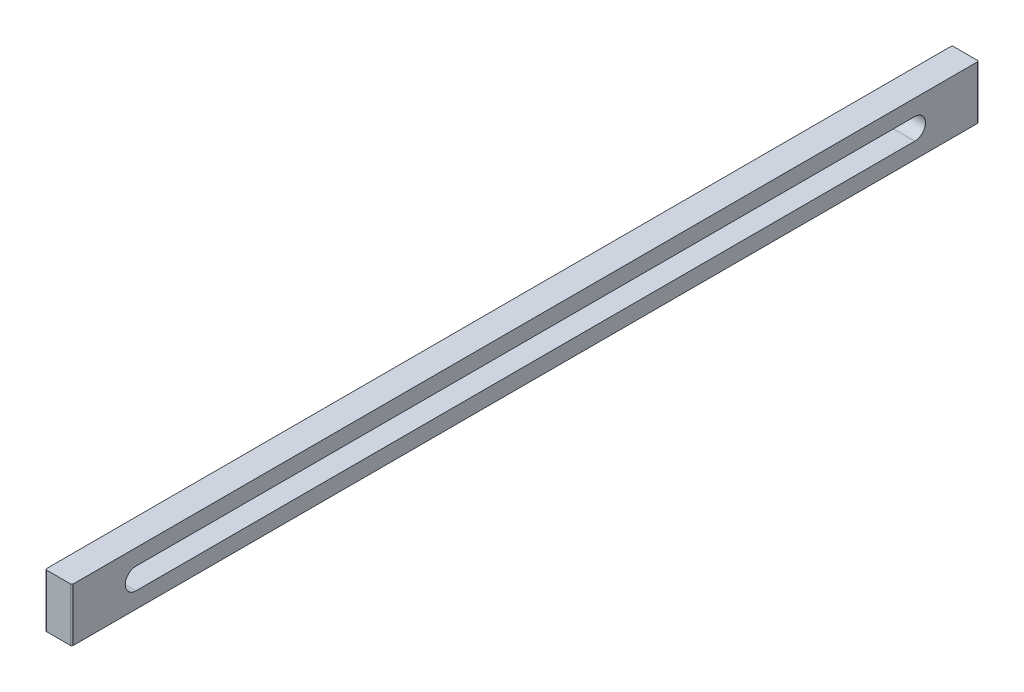
from build123d import *

# Parameters (mm, degrees)
BOSS_EXTRUDE1_DEPTH = 10
CUT_EXTRUDE1_DEPTH  = 10


with BuildPart() as part:
    # Sketch1 → Boss-Extrude1 (new body)
    with BuildSketch(Plane(origin=(0, 0, 0), x_dir=(1, 0, 0), z_dir=(0, 1, 0))):
        with BuildLine():
            Line((11.152393634, 3.852474108), (11.152393634, 173.352474108))
            ThreePointArc((11.152393634, 173.352474108), (11.225616938, 173.529250803), (11.402393634, 173.602474108))
            Line((11.402393634, 173.602474108), (15.902393634, 173.602474108))
            ThreePointArc((15.902393634, 173.602474108), (16.079170329, 173.529250803), (16.152393634, 173.352474108))
            Line((16.152393634, 173.352474108), (16.152393634, 3.852474108))
            ThreePointArc((16.152393634, 3.852474108), (16.079170329, 3.675697413), (15.902393634, 3.602474108))
            Line((15.902393634, 3.602474108), (11.402393634, 3.602474108))
            ThreePointArc((11.402393634, 3.602474108), (11.225616938, 3.675697413), (11.152393634, 3.852474108))
        make_face()
    extrude(amount=BOSS_EXTRUDE1_DEPTH)

    # Sketch2 → Cut-Extrude1 (cut)
    with BuildSketch(Plane(origin=(16.152393634, 0, 0), x_dir=(0, 0, -1), z_dir=(1, 0, 0))):
        with BuildLine():
            Line((15.602474108, 7), (161.602474108, 7))
            ThreePointArc((161.602474108, 7), (163.602474108, 5), (161.602474108, 3))
            Line((161.602474108, 3), (15.602474108, 3))
            ThreePointArc((15.602474108, 3), (13.602474108, 5), (15.602474108, 7))
        make_face()
    extrude(amount=-CUT_EXTRUDE1_DEPTH, mode=Mode.SUBTRACT)


solid = part.part
